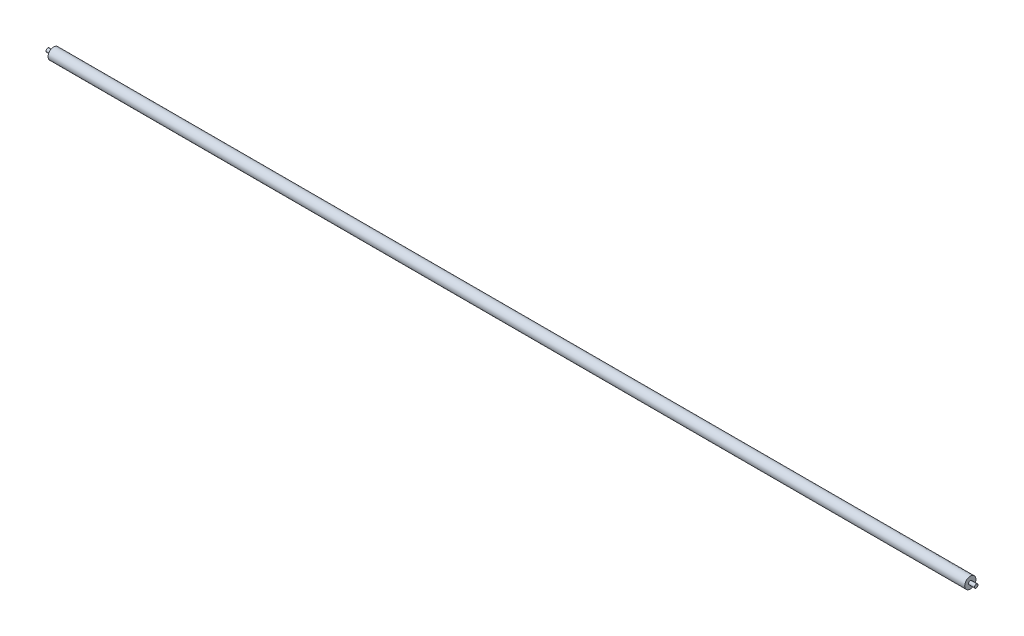
from build123d import *

# Parameters (mm, degrees)
SKETCH1_R           = 9.5
BOSS_EXTRUDE1_DEPTH = 1554
SKETCH2_R           = 3
BOSS_EXTRUDE2_DEPTH = 10
BOSS_EXTRUDE3_START = 10
SKETCH3_R           = 3
BOSS_EXTRUDE3_DEPTH = 10


with BuildPart() as part:
    # Sketch1 → Boss-Extrude1 (new body)
    with BuildSketch(Plane(origin=(0, 0, 0), x_dir=(0, 0, -1), z_dir=(1, 0, 0))):
        Circle(SKETCH1_R)
    extrude(amount=BOSS_EXTRUDE1_DEPTH)

    # Sketch2 → Boss-Extrude2 (add)
    with BuildSketch(Plane.ZY):
        Circle(SKETCH2_R)
    extrude(amount=BOSS_EXTRUDE2_DEPTH)

    # Sketch3 → Boss-Extrude3 (add)
    with BuildSketch(Plane(origin=(1554, 0, 0), x_dir=(0, 0, -1), z_dir=(1, 0, 0)).offset(BOSS_EXTRUDE3_START)):
        Circle(SKETCH3_R)
    extrude(amount=-BOSS_EXTRUDE3_DEPTH)


solid = part.part
